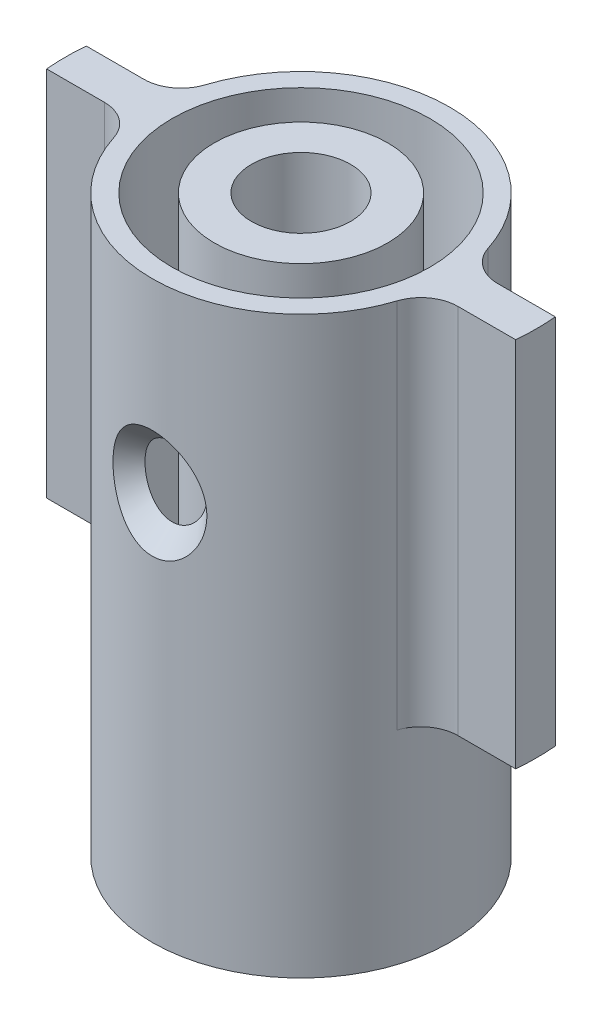
from build123d import *

# Parameters (mm, degrees)
SKETCH1_R           = 3.5
SKETCH1_R_2         = 2
BOSS_EXTRUDE1_DEPTH = 20
SKETCH1_3_R         = 6
BOSS_EXTRUDE2_DEPTH = 3.2
SKETCH1_4_R         = 6
BOSS_EXTRUDE3_DEPTH = 5
SKETCH2_R           = 5.2
BOSS_EXTRUDE4_DEPTH = 15
CIRPATTERN1_COUNT   = 2
FILLET1_R           = 1.5


with BuildPart() as part:
    # Sketch1 → Boss-Extrude1 (new body)
    with BuildSketch(Plane(origin=(0, 0, 0), x_dir=(1, 0, 0), z_dir=(0, 1, 0))):
        with Locations(Location((0, 0, 0), (0, 0, 270))):
            Circle(SKETCH1_R)
        with Locations(Location((0, 0, 0), (0, 0, 270))):
            Circle(SKETCH1_R_2, mode=Mode.SUBTRACT)
    extrude(amount=BOSS_EXTRUDE1_DEPTH)



with BuildPart() as body_2:
    # Sketch1<3> → Boss-Extrude2 (new body)
    with BuildSketch(Plane(origin=(0, 0, 0), x_dir=(1, 0, 0), z_dir=(0, 1, 0))):
        with Locations(Location((0, 0, 0), (0, 0, 270))):
            Circle(SKETCH1_3_R)
        Polygon((0, -4.041451884), (3.5, -2.020725942), (3.5, 2.020725942), (0, 4.041451884), (-3.5, 2.020725942), (-3.5, -2.020725942), align=None, mode=Mode.SUBTRACT)
    extrude(amount=-BOSS_EXTRUDE2_DEPTH)


with BuildPart() as part_1:
    add(part.part)

    add(body_2.part)  # Boss-Extrude3 merges body 2
    # Sketch1<4> → Boss-Extrude3 (add)
    # profile 1 of 7: a face of its own
    with BuildSketch(Plane(origin=(0, 0, 0), x_dir=(1, 0, 0), z_dir=(0, 1, 0))):
        with Locations(Location((0, 0, 0), (0, 0, 270))):
            Circle(SKETCH1_4_R)
        Polygon((0, -4.041451884), (3.5, -2.020725942), (3.5, 2.020725942), (0, 4.041451884), (-3.5, 2.020725942), (-3.5, -2.020725942), align=None, mode=Mode.SUBTRACT)
    # profile 2 of 7: a face of its own
    with BuildSketch(Plane(origin=(0, 0, 0), x_dir=(1, 0, 0), z_dir=(0, 1, 0))):
        with BuildLine():
            ThreePointArc((-1.749999906, 3.031088968), (8.8e-08, 3.5), (1.750000057, 3.03108888))
            Line((1.750000057, 3.03108888), (0, 4.041451884))
            Line((0, 4.041451884), (-1.749999906, 3.031088968))
        make_face()
    # profile 3 of 7: a face of its own
    with BuildSketch(Plane(origin=(0, 0, 0), x_dir=(1, 0, 0), z_dir=(0, 1, 0))):
        with BuildLine():
            ThreePointArc((1.750000057, 3.03108888), (3.03108893, 1.749999971), (3.5, 0))
            Line((3.5, 0), (3.5, 2.020725942))
            Line((3.5, 2.020725942), (1.750000057, 3.03108888))
        make_face()
    # profile 4 of 7: a face of its own
    with BuildSketch(Plane(origin=(0, 0, 0), x_dir=(1, 0, 0), z_dir=(0, 1, 0))):
        with BuildLine():
            Line((1.750000074, -3.03108887), (3.5, -2.020725942))
            Line((3.5, -2.020725942), (3.5, 0))
            ThreePointArc((3.5, 0), (3.031088935, -1.749999963), (1.750000074, -3.03108887))
        make_face()
    # profile 5 of 7: a face of its own
    with BuildSketch(Plane(origin=(0, 0, 0), x_dir=(1, 0, 0), z_dir=(0, 1, 0))):
        with BuildLine():
            Line((0, -4.041451884), (1.750000074, -3.03108887))
            ThreePointArc((1.750000074, -3.03108887), (5.1e-08, -3.5), (-1.749999986, -3.031088921))
            Line((-1.749999986, -3.031088921), (0, -4.041451884))
        make_face()
    # profile 6 of 7: a face of its own
    with BuildSketch(Plane(origin=(0, 0, 0), x_dir=(1, 0, 0), z_dir=(0, 1, 0))):
        with BuildLine():
            Line((-3.5, -2.020725942), (-1.749999986, -3.031088921))
            ThreePointArc((-1.749999986, -3.031088921), (-3.031088909, -1.750000007), (-3.5, 0))
            Line((-3.5, 0), (-3.5, -2.020725942))
        make_face()
    # profile 7 of 7: a face of its own
    with BuildSketch(Plane(origin=(0, 0, 0), x_dir=(1, 0, 0), z_dir=(0, 1, 0))):
        with BuildLine():
            ThreePointArc((-3.5, 0), (-3.031088886, 1.750000047), (-1.749999906, 3.031088968))
            Line((-1.749999906, 3.031088968), (-3.5, 2.020725942))
            Line((-3.5, 2.020725942), (-3.5, 0))
        make_face()
    extrude(amount=BOSS_EXTRUDE3_DEPTH)

    # Sketch2 → Boss-Extrude4 (add)
    with BuildSketch(Plane(origin=(0, 5, 0), x_dir=(1, 0, 0), z_dir=(0, 1, 0))):
        with BuildLine():
            Line((-9.46625586, -0.8), (-5.946427499, -0.8))
            ThreePointArc((-5.946427499, -0.8), (0, -6), (5.946427499, -0.8))
            Line((5.946427499, -0.8), (9.46625586, -0.8))
            ThreePointArc((9.46625586, -0.8), (9.5, 0), (9.46625586, 0.8))
            Line((9.46625586, 0.8), (5.946427499, 0.8))
            ThreePointArc((5.946427499, 0.8), (0, 6), (-5.946427499, 0.8))
            Line((-5.946427499, 0.8), (-9.46625586, 0.8))
            ThreePointArc((-9.46625586, 0.8), (-9.5, 0), (-9.46625586, -0.8))
        make_face()
        with Locations(Location((0, 0, 0), (0, 0, 270))):
            Circle(SKETCH2_R, mode=Mode.SUBTRACT)
    extrude(amount=BOSS_EXTRUDE4_DEPTH)

    # Sketch5 → CSK for M2 Flat Head Machine Screw1 (revolve, cut)
    with BuildSketch(Plane(origin=(0, 12.5, -6), x_dir=(0, 1, 0), z_dir=(1, 0, 0))):
        Polygon((0, 0), (0, 5), (1.2, 4.278967257), (1.2, 1), (2.2, 0), align=None)
    csk_for_m2_flat_head_machine_screw1 = revolve(axis=Axis((0, 12.5, -12.35), (0, 0, 1)), mode=Mode.SUBTRACT)

    # CirPattern1: CSK for M2 Flat Head Machine Screw1 ×2 about axis
    cirpattern1_axis = Axis((0, 5, 0), (0, -1, 0))
    for i in range(1, CIRPATTERN1_COUNT):
        add(csk_for_m2_flat_head_machine_screw1.rotate(cirpattern1_axis, i * 360 / CIRPATTERN1_COUNT), mode=Mode.SUBTRACT)

    # Fillet1
    # the kernel refuses this fillet: 1.5 mm, written as the material it adds along each edge
    with BuildSketch(Plane(origin=(-5.946427499, 5, 0.8), x_dir=(-1, 0, 0), z_dir=(0, 1, 0)), Plane(origin=(5.946427499, 5, -0.8), x_dir=(1, 0, 0), z_dir=(0, 1, 0))) as fillet1_piece_1:
        with BuildLine():
            CenterArc((1.19219982, 1.5), FILLET1_R, 197.858462698, 72.141537302)
            ThreePointArc((-0.235525644, 1.04), (-0.094613086, 0.52524265), (0, 0))
            Line((0, 0), (1.19219982, 0))
        make_face()
    extrude(amount=15)
    with BuildSketch(Plane(origin=(5.946427499, 5, 0.8), x_dir=(1, 0, 0), z_dir=(0, 1, 0)), Plane(origin=(-5.946427499, 5, -0.8), x_dir=(-1, 0, 0), z_dir=(0, 1, 0))) as fillet1_piece_2:
        with BuildLine():
            CenterArc((1.19219982, -1.5), FILLET1_R, 90, 72.141537302)
            ThreePointArc((-0.235525644, -1.04), (-0.094613086, -0.52524265), (0, 0))
            Line((0, 0), (1.19219982, 0))
        make_face()
    extrude(amount=15)


solid = part_1.part
